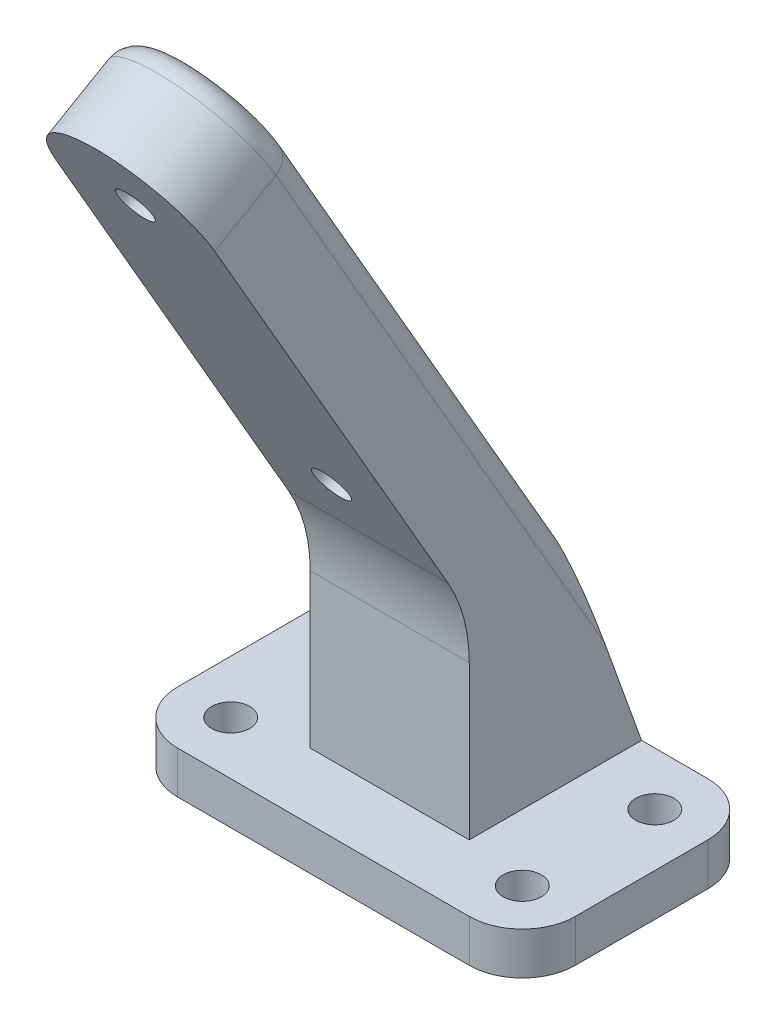
from build123d import *

# Parameters (mm, degrees)
SKETCH_1_W          = 37.5
SKETCH_1_H          = 22.5
EXTRUDE_2_DEPTH     = 4
SKETCH_2_W          = 15
SKETCH_2_H          = 10
EXTRUDE_3_DEPTH     = 18.5
EXTRUDE_4_DEPTH     = 15
EXTRUDE_5_DEPTH     = 8.66025404
SKETCH_5_R          = 1.7
CUT_EXTRUDE_1_DEPTH = 10
FILLET_1_R          = 15
FILLET_3_R          = 5
SKETCH_9_R          = 1.8
CUT_EXTRUDE_2_DEPTH = 4
FILLET_5_R          = 10
RIB_10_REACH        = 84.489
SKETCH_16_WALL_W    = 186.275176358
SKETCH_16_WALL_H    = 4
RIB_START           = -4
RIB_11_DEPTH        = 4
FILLET_6_R          = 2


# Read off the part's stored shape, not the designer's step: 筋11
with BuildPart() as part:
    # 草图1 → 凸台-拉伸2 (new body)
    with BuildSketch(Plane(origin=(0, 0, 0), x_dir=(1, 0, 0), z_dir=(0, 1, 0))):
        with Locations((18.75, 11.25)):
            Rectangle(SKETCH_1_W, SKETCH_1_H)
    extrude(amount=EXTRUDE_2_DEPTH)

    # 草图2 → 凸台-拉伸3 (add)
    with BuildSketch(Plane(origin=(0, 4, 0), x_dir=(1, 0, 0), z_dir=(0, 1, 0))):
        with Locations((18.75, 11.25)):
            Rectangle(SKETCH_2_W, SKETCH_2_H)
    extrude(amount=EXTRUDE_3_DEPTH)

    # 草图3 → 凸台-拉伸4 (add)
    with BuildSketch(Plane(origin=(26.25, 0, 0), x_dir=(0, 0, -1), z_dir=(1, 0, 0))):
        Polygon((6.25, 22.5), (-17.75, 64.069219382), (-10.25, 68.399346401), (16.25, 22.5), align=None)
    extrude(amount=-EXTRUDE_4_DEPTH)

    # 草图4 → 凸台-拉伸5 (add)
    with BuildSketch(Plane(origin=(0, 8.331329387, -14.430285793), x_dir=(1, 0, 0), z_dir=(0, -0.5000000000000041, 0.8660254037844363))):
        with BuildLine():
            Line((26.25, 64.360571585), (11.25, 64.360571585))
            ThreePointArc((11.25, 64.360571585), (18.75, 71.860571585), (26.25, 64.360571585))
        make_face()
    extrude(amount=-EXTRUDE_5_DEPTH)

    # 草图5 → 切除-拉伸1 (cut)
    with BuildSketch(Plane(origin=(0, 8.331329387, -14.430285793), x_dir=(1, 0, 0), z_dir=(0, -0.5000000000000041, 0.8660254037844363))):
        with Locations(Location((18.75, 64.360571585, 0), (0, 0, 270))):
            Circle(SKETCH_5_R)
        with Locations(Location((18.75, 27.360571585, 0), (0, 0, 270))):
            Circle(SKETCH_5_R)
    extrude(amount=-CUT_EXTRUDE_1_DEPTH, mode=Mode.SUBTRACT)

    # 圆角1
    fillet_1_edges = [part.edges().sort_by_distance(p)[0] for p in [
        (18.75, 22.5, -6.25),
    ]]
    fillet(fillet_1_edges, radius=FILLET_1_R)

    # 圆角3
    fillet_3_edges = [part.edges().sort_by_distance(p)[0] for p in [
        (0, 2, -22.5),
        (37.5, 2, -22.5),
        (37.5, 2, 0),
        (0, 2, 0),
    ]]
    fillet(fillet_3_edges, radius=FILLET_3_R)

    # 草图9 → 切除-拉伸2 (cut)
    with BuildSketch(Plane(origin=(0, 4, 0), x_dir=(1, 0, 0), z_dir=(0, 1, 0))):
        with Locations(Location((5, 17.5, 0), (0, 0, 270))):
            Circle(SKETCH_9_R)
        with Locations(Location((32.5, 17.5, 0), (0, 0, 90))):
            Circle(SKETCH_9_R)
        with Locations(Location((32.5, 5, 0), (0, 0, 270))):
            Circle(SKETCH_9_R)
        with Locations(Location((5, 5, 0), (0, 0, 90))):
            Circle(SKETCH_9_R)
    extrude(amount=-CUT_EXTRUDE_2_DEPTH, mode=Mode.SUBTRACT)

    # 圆角5
    fillet_5_edges = [part.edges().sort_by_distance(p)[0] for p in [
        (18.75, 22.5, -16.25),
    ]]
    fillet(fillet_5_edges, radius=FILLET_5_R)

    # 草图16 wall → 筋10 (add, up to next)
    with BuildSketch(Plane(origin=(26.25, 13.079426042, -19.236382193), x_dir=(0, 0.941051653324, 0.33826289447), z_dir=(0, -0.33826289447, 0.941051653324)), mode=Mode.PRIVATE) as rib_10_sk1:
        with Locations((0, 2)):
            Rectangle(SKETCH_16_WALL_W, SKETCH_16_WALL_H)
    rib_10_tool1 = extrude(rib_10_sk1.sketch, amount=RIB_10_REACH, mode=Mode.PRIVATE) - part.part
    add(rib_10_tool1.solids().sort_by_distance((26.25, 13.079426042, -19.236382193))[0])

    # 筋11 outline → 筋11 (add)
    with BuildSketch(Plane.ZY.offset(-11.25).offset(RIB_START)):
        with BuildLine():
            Line((-15.98478303, 22.108301633), (-22.5, 4))
            Line((-22.5, 4), (-16.25, 4))
            Line((-16.25, 4), (-16.25, 19.820508076))
            ThreePointArc((-16.25, 19.820508076), (-16.183474475, 20.972065652), (-15.98478303, 22.108301633))
        make_face()
    extrude(amount=RIB_11_DEPTH)

    # 圆角6
    # the kernel refuses this fillet: 2 mm, written as the material it takes off along each edge
    with BuildSketch(Plane(origin=(11.25, 68.399346401, 10.25), x_dir=(1.7763568394002473e-15, -0.5000000000000042, 0.8660254037844363), z_dir=(0, -0.8660254037844363, -0.5000000000000042)), Plane(origin=(26.25, 68.399346401, 10.25), x_dir=(-1, 0, 0), z_dir=(0, -0.8660254037844363, -0.5000000000000042))) as fillet_6_piece_1:
        with BuildLine():
            CenterArc((FILLET_6_R, -FILLET_6_R), FILLET_6_R, 90, 90)
            Line((0, -FILLET_6_R), (-FILLET_6_R * 0.02, -FILLET_6_R))
            Line((-FILLET_6_R * 0.02, -FILLET_6_R), (-FILLET_6_R * 0.02, FILLET_6_R * 0.02))
            Line((-FILLET_6_R * 0.02, FILLET_6_R * 0.02), (FILLET_6_R, FILLET_6_R * 0.02))
            Line((FILLET_6_R, FILLET_6_R * 0.02), (FILLET_6_R, 0))
        make_face()
    extrude(amount=62.320508076, mode=Mode.SUBTRACT)
    with BuildSketch(Plane(origin=(18.75, 68.399346402, 10.249999998), x_dir=(-1, 0, 0), z_dir=(0, -0.8660254037844363, -0.5000000000000041))) as fillet_6_piece_2:
        with BuildLine():
            CenterArc((7.5 - FILLET_6_R, -FILLET_6_R * 1.00000000108), FILLET_6_R, 360, 90)
            Line((7.5, -FILLET_6_R * 1.00000000108), (7.5 + FILLET_6_R * 0.02, -FILLET_6_R * 1.00000000108))
            Line((7.5 + FILLET_6_R * 0.02, -FILLET_6_R * 1.00000000108), (7.5 + FILLET_6_R * 0.02, FILLET_6_R * 0.02))
            Line((7.5 + FILLET_6_R * 0.02, FILLET_6_R * 0.02), (7.5 - FILLET_6_R, FILLET_6_R * 0.0199999989222))
            Line((7.5 - FILLET_6_R, FILLET_6_R * 0.0199999989222), (7.5 - FILLET_6_R, -FILLET_6_R * 1.07782831552e-09))
        make_face()
    revolve(axis=Axis((18.75, 68.399346402, 10.249999998), (0, 0.5000000000000041, -0.8660254037844363)), revolution_arc=180, mode=Mode.SUBTRACT)


solid = part.part
